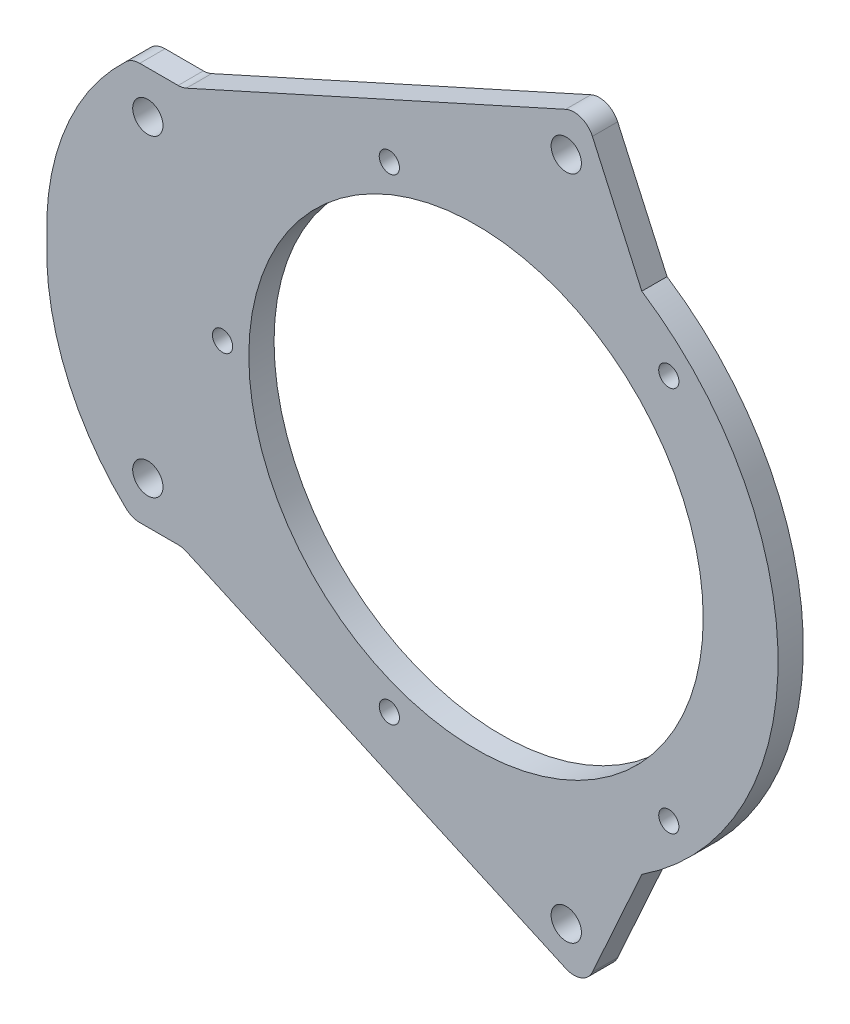
from build123d import *

# Parameters (mm, degrees)
CROQUIS1_R              = 2.25
CROQUIS1_R_2            = 3
CROQUIS1_R_3            = 1.5
CROQUIS1_R_4            = 2.249997567
SALIENTE_EXTRUIR1_DEPTH = 2.5
SALIENTE_EXTRUIR3_START = -2.5
CROQUIS6_R              = 2.250000066
CROQUIS6_R_2            = 1.5
CROQUIS6_R_3            = 2.25
SALIENTE_EXTRUIR3_DEPTH = 2.5
CROQUIS5_R              = 22.5
CROQUIS5_R_2            = 1
CORTAR_EXTRUIR5_DEPTH   = 2.5
CORTAR_EXTRUIR6_DEPTH   = 2.5
SALIENTE_EXTRUIR4_START = -2.5
CROQUIS11_R             = 1.5
CROQUIS11_R_2           = 1.500000006
SALIENTE_EXTRUIR4_DEPTH = 2.5
REDONDEO1_START         = -1
REDONDEO1_DEPTH         = 4
REDONDEO1_2_DEPTH       = 2.5
CROQUIS12_R             = 1.5
CORTAR_EXTRUIR7_DEPTH   = 2.5


with BuildPart() as part:
    # Croquis1 → Saliente-Extruir1 (new body)
    with BuildSketch(Plane.XY):
        with BuildLine():
            Line((-29.502526327, -44.949972179), (-23.17778065, -37.243838032))
            ThreePointArc((-23.17778065, -37.243838032), (-18.839723212, -32.444384768), (-14.046056443, -28.099933953))
            ThreePointArc((-14.046056443, -28.099933953), (-12.991422185, -27.658257217), (-11.867164621, -27.866527921))
            ThreePointArc((-11.867164621, -27.866527921), (-11.203313373, -28.112469078), (-10.500314, -28.196))
            Line((-10.500314, -28.196), (10.499686, -28.196))
            ThreePointArc((10.499686, -28.196), (11.203007921, -28.112542722), (11.867164264, -27.866528101))
            ThreePointArc((11.867164264, -27.866528101), (12.991422421, -27.658256674), (14.046057406, -28.099933523))
            ThreePointArc((14.046057406, -28.099933523), (18.839775902, -32.444337151), (23.177889012, -37.243749049))
            Line((23.177889012, -37.243749049), (29.502526012, -44.949972049))
            ThreePointArc((29.502526012, -44.949972049), (40.113877497, -46.255199126), (41.931739547, -35.719556022))
            Line((41.931739547, -35.719556022), (21.72923101, -5.566101046))
            ThreePointArc((21.72923101, -5.566101046), (20.036969431, -9.5e-08), (21.729230693, 5.566100954))
            Line((21.729230693, 5.566100954), (41.931739693, 35.719555954))
            ThreePointArc((41.931739693, 35.719555954), (40.113877277, 46.255198335), (29.502526336, 44.949972165))
            Line((29.502526336, 44.949972165), (23.17778065, 37.243838007))
            ThreePointArc((23.17778065, 37.243838007), (18.839723212, 32.444384742), (14.046056443, 28.099933927))
            ThreePointArc((14.046056443, 28.099933927), (12.991421988, 27.658257139), (11.867164252, 27.866528027))
            ThreePointArc((11.867164252, 27.866528027), (11.203313175, 28.112469073), (10.500314, 28.195999974))
            Line((10.500314, 28.195999974), (-10.500314, 28.195999974))
            ThreePointArc((-10.500314, 28.195999974), (-11.203313178, 28.112469098), (-11.867164264, 27.866528075))
            ThreePointArc((-11.867164264, 27.866528075), (-12.991422421, 27.658256648), (-14.046057406, 28.099933497))
            ThreePointArc((-14.046057406, 28.099933497), (-18.839775902, 32.444337126), (-23.177889012, 37.243749023))
            Line((-23.177889012, 37.243749023), (-29.502526012, 44.949972023))
            ThreePointArc((-29.502526012, 44.949972023), (-40.146302424, 46.230987494), (-41.886340556, 35.652554517))
            ThreePointArc((-41.886340556, 35.652554517), (-41.288874902, 25.337679941), (-50.13550001, 20.000000021))
            Line((-50.13550001, 20.000000021), (-97.31807601, 20.000000021))
            ThreePointArc((-97.31807601, 20.000000021), (-99.1994919, 19.554558541), (-100.681450855, 18.312809163))
            add(Edge.make_bspline(
                [(-107.31807554, 2.1e-08), (-107.252414123, 7.059743944), (-104.975710329, 13.164639039), (-100.681450855, 18.312809163)],
                knots=[0, 0, 0, 0, 1, 1, 1, 1], degree=3))
            add(Edge.make_bspline(
                [(-107.31807554, 2.1e-08), (-107.252414123, -7.059743902), (-104.975710329, -13.164638997), (-100.681450855, -18.312809121)],
                knots=[0, 0, 0, 0, 1, 1, 1, 1], degree=3))
            ThreePointArc((-100.681450855, -18.312809121), (-99.19949186, -19.554558345), (-97.31807601, -19.9999997))
            Line((-97.31807601, -19.9999997), (-50.13550001, -19.9999997))
            ThreePointArc((-50.13550001, -19.9999997), (-41.288874902, -25.33767962), (-41.886340556, -35.652554196))
            ThreePointArc((-41.886340556, -35.652554196), (-40.146302646, -46.230987042), (-29.502526327, -44.949972179))
        make_face()
        with Locations((-25.371621, 27.641642)):
            Circle(CROQUIS1_R, mode=Mode.SUBTRACT)
        with Locations((-35.493242035, 40.033284004)):
            Circle(CROQUIS1_R, mode=Mode.SUBTRACT)
        with Locations((-35.49324201, -40.0332837)):
            Circle(CROQUIS1_R, mode=Mode.SUBTRACT)
        with Locations((15.25, -15.25)):
            Circle(CROQUIS1_R_2, mode=Mode.SUBTRACT)
        with Locations((35.493242035, -40.03328403)):
            Circle(CROQUIS1_R, mode=Mode.SUBTRACT)
        with Locations((-15.25, 15.25)):
            Circle(CROQUIS1_R_2, mode=Mode.SUBTRACT)
        with Locations((-25.371621, -27.641642)):
            Circle(CROQUIS1_R, mode=Mode.SUBTRACT)
        with Locations((-35.318076, 15.5)):
            Circle(CROQUIS1_R_3, mode=Mode.SUBTRACT)
        with Locations((25.371621, -27.641642)):
            Circle(CROQUIS1_R, mode=Mode.SUBTRACT)
        with Locations((-15.25, -15.25)):
            Circle(CROQUIS1_R_2, mode=Mode.SUBTRACT)
        with Locations((-97.318076, 15.5)):
            Circle(CROQUIS1_R_3, mode=Mode.SUBTRACT)
        with Locations((15.25, 15.25)):
            Circle(CROQUIS1_R_2, mode=Mode.SUBTRACT)
        with Locations((-35.318076, -15.5)):
            Circle(CROQUIS1_R_3, mode=Mode.SUBTRACT)
        with Locations((25.371621, 27.641642)):
            Circle(CROQUIS1_R, mode=Mode.SUBTRACT)
        with Locations((-97.318076, -15.5)):
            Circle(CROQUIS1_R_3, mode=Mode.SUBTRACT)
        with Locations((35.493241695, 40.03328329)):
            Circle(CROQUIS1_R_4, mode=Mode.SUBTRACT)
        with BuildLine():
            Line((10.499686, -24.196), (-10.500314, -24.196))
            ThreePointArc((-10.500314, -24.196), (-11.500314, -25.196), (-10.500314, -26.196))
            Line((-10.500314, -26.196), (10.499686, -26.196))
            ThreePointArc((10.499686, -26.196), (11.499686, -25.196), (10.499686, -24.196))
        make_face(mode=Mode.SUBTRACT)
        with BuildLine():
            Line((10.499686, 24.196), (-10.500314, 24.196))
            ThreePointArc((-10.500314, 24.196), (-11.500314, 25.196), (-10.500314, 26.196))
            Line((-10.500314, 26.196), (10.499686, 26.196))
            ThreePointArc((10.499686, 26.196), (11.499686, 25.196), (10.499686, 24.196))
        make_face(mode=Mode.SUBTRACT)
    extrude(amount=SALIENTE_EXTRUIR1_DEPTH)


with BuildPart() as saliente_extruir3_tool:
    # Croquis6 → Saliente-Extruir3 (new body)
    # profile 1 of 10: a face of its own
    with BuildSketch(Plane.XY.offset(2.5).offset(SALIENTE_EXTRUIR3_START)):
        with Locations((-35.493242163, 40.033284025)):
            Circle(CROQUIS6_R)
        with Locations((-35.493242163, 40.033284025)):
            Circle(CROQUIS6_R_2, mode=Mode.SUBTRACT)
    # profile 2 of 10: a face of its own
    with BuildSketch(Plane.XY.offset(2.5).offset(SALIENTE_EXTRUIR3_START)):
        with Locations((-25.371621, 27.641642)):
            Circle(CROQUIS6_R_3)
        with Locations((-25.371621, 27.641642)):
            Circle(CROQUIS6_R_2, mode=Mode.SUBTRACT)
    # profile 3 of 10: a face of its own
    with BuildSketch(Plane.XY.offset(2.5).offset(SALIENTE_EXTRUIR3_START)):
        with Locations((25.371621, 27.641642)):
            Circle(CROQUIS6_R_3)
        with Locations(Location((25.371621, 27.641642, 0), (0, 0, 180))):
            Circle(CROQUIS6_R_2, mode=Mode.SUBTRACT)
    # profile 4 of 10: a face of its own
    with BuildSketch(Plane.XY.offset(2.5).offset(SALIENTE_EXTRUIR3_START)):
        with Locations((35.493242163, 40.033284025)):
            Circle(CROQUIS6_R)
        with Locations(Location((35.493242163, 40.033284025, 0), (0, 0, 180))):
            Circle(CROQUIS6_R_2, mode=Mode.SUBTRACT)
    # profile 5 of 10: a face of its own
    with BuildSketch(Plane.XY.offset(2.5).offset(SALIENTE_EXTRUIR3_START)):
        with Locations((35.493242163, -40.033284025)):
            Circle(CROQUIS6_R)
        with Locations((35.493242163, -40.033284025)):
            Circle(CROQUIS6_R_2, mode=Mode.SUBTRACT)
    # profile 6 of 10: a face of its own
    with BuildSketch(Plane.XY.offset(2.5).offset(SALIENTE_EXTRUIR3_START)):
        with Locations((25.371621, -27.641642)):
            Circle(CROQUIS6_R_3)
        with Locations((25.371621, -27.641642)):
            Circle(CROQUIS6_R_2, mode=Mode.SUBTRACT)
    # profile 7 of 10: a face of its own
    with BuildSketch(Plane.XY.offset(2.5).offset(SALIENTE_EXTRUIR3_START)):
        with Locations((-25.371621, -27.641642)):
            Circle(CROQUIS6_R_3)
        with Locations(Location((-25.371621, -27.641642, 0), (0, 0, 180))):
            Circle(CROQUIS6_R_2, mode=Mode.SUBTRACT)
    # profile 8 of 10: a face of its own
    with BuildSketch(Plane.XY.offset(2.5).offset(SALIENTE_EXTRUIR3_START)):
        with Locations((-35.493242163, -40.033284025)):
            Circle(CROQUIS6_R)
        with Locations(Location((-35.493242163, -40.033284025, 0), (0, 0, 180))):
            Circle(CROQUIS6_R_2, mode=Mode.SUBTRACT)
    # profile 9 of 10: a face of its own
    with BuildSketch(Plane.XY.offset(2.5).offset(SALIENTE_EXTRUIR3_START)):
        with BuildLine():
            Line((-99.1994919, 19.554558541), (-40.146302424, 46.230987494))
            ThreePointArc((-40.146302424, 46.230987494), (-43.140478024, 41.291171845), (-41.886340556, 35.652554517))
            ThreePointArc((-41.886340556, 35.652554517), (-41.288875033, 25.33768001), (-50.13550001, 20.000000021))
            Line((-50.13550001, 20.000000021), (-97.31807601, 20.000000021))
            ThreePointArc((-97.31807601, 20.000000021), (-98.214581153, 19.590579436), (-99.1994919, 19.554558541))
        make_face()
    # profile 10 of 10: a face of its own
    with BuildSketch(Plane.XY.offset(2.5).offset(SALIENTE_EXTRUIR3_START)):
        with BuildLine():
            Line((-50.13550001, -20.000000021), (-97.31807601, -20.000000021))
            ThreePointArc((-97.31807601, -20.000000021), (-98.214581153, -19.590579436), (-99.1994919, -19.554558541))
            Line((-99.1994919, -19.554558541), (-40.146302424, -46.230987494))
            ThreePointArc((-40.146302424, -46.230987494), (-43.140478024, -41.291171845), (-41.886340556, -35.652554517))
            ThreePointArc((-41.886340556, -35.652554517), (-41.288875033, -25.33768001), (-50.13550001, -20.000000021))
        make_face()
    extrude(amount=SALIENTE_EXTRUIR3_DEPTH)


with BuildPart() as part_1:
    add(part.part)


with BuildPart() as part_2:
    # Saliente-Extruir3: joined with saliente_extruir3_tool
    add(part_1.part.fuse(saliente_extruir3_tool.part, tol=0.00001))

    # Croquis5 → Cortar-Extruir5 (cut)
    with BuildSketch(Plane.XY.offset(2.5)):
        with Locations((-69.81807554, 2.1e-08)):
            Circle(CROQUIS5_R)
        with Locations((-78.402781137, 23.586284803)):
            Circle(CROQUIS5_R_2)
        with Locations((-94.91807554, 2.1e-08)):
            Circle(CROQUIS5_R_2)
        with Locations(Location((-78.402781137, -23.586284761, 0), (0, 0, 180))):
            Circle(CROQUIS5_R_2)
        with Locations((-50.726192448, 19.091883113)):
            Circle(CROQUIS5_R_2)
        with Locations(Location((-50.726192448, -19.091883071, 0), (0, 0, 180))):
            Circle(CROQUIS5_R_2)
    extrude(amount=-CORTAR_EXTRUIR5_DEPTH, mode=Mode.SUBTRACT)

    # Croquis10 → Cortar-Extruir6 (cut)
    with BuildSketch(Plane.XY.offset(2.5)):
        with BuildLine():
            ThreePointArc((-82.134030611, -27.263635217), (-39.901716207, 2.1e-08), (-82.134030596, 27.263635224))
            ThreePointArc((-82.134030596, 27.263635224), (79.537301339, -4.3e-08), (-82.134030611, -27.263635217))
        make_face()
    extrude(amount=-CORTAR_EXTRUIR6_DEPTH, mode=Mode.SUBTRACT)

    # Croquis11 → Saliente-Extruir4 (add)
    # profile 1 of 5: a face of its own
    with BuildSketch(Plane.XY.offset(2.5).offset(SALIENTE_EXTRUIR4_START)):
        with Locations((-97.318076, 15.5)):
            Circle(CROQUIS11_R)
    # profile 2 of 5: a face of its own
    with BuildSketch(Plane.XY.offset(2.5).offset(SALIENTE_EXTRUIR4_START)):
        with Locations((-97.318076, -15.5)):
            Circle(CROQUIS11_R)
    # profile 3 of 5: a face of its own
    with BuildSketch(Plane.XY.offset(2.5).offset(SALIENTE_EXTRUIR4_START)):
        with BuildLine():
            Line((-82.134030604, -27.263635221), (-59.115036511, -37.6621347))
            Line((-59.115036511, -37.6621347), (-53.398623675, -25.007801874))
            ThreePointArc((-53.398623675, -25.007801874), (-67.476736709, -29.824598689), (-82.134030604, -27.263635221))
        make_face()
        with Locations((-60.881562628, -32.984594162)):
            Circle(CROQUIS11_R_2, mode=Mode.SUBTRACT)
    # profile 4 of 5: a face of its own
    with BuildSketch(Plane.XY.offset(2.5).offset(SALIENTE_EXTRUIR4_START)):
        with BuildLine():
            Line((-53.398623675, 25.007801874), (-59.115036511, 37.6621347))
            Line((-59.115036511, 37.6621347), (-82.134030604, 27.263635221))
            ThreePointArc((-82.134030604, 27.263635221), (-67.476736709, 29.824598692), (-53.398623675, 25.007801874))
        make_face()
        with Locations((-60.881562628, 32.984594162)):
            Circle(CROQUIS11_R, mode=Mode.SUBTRACT)
    # profile 5 of 5: a face of its own
    with BuildSketch(Plane.XY.offset(2.5).offset(SALIENTE_EXTRUIR4_START)):
        with BuildLine():
            Line((-98.888624327, -19.694988496), (-103.888624327, -19.694988496))
            ThreePointArc((-103.888624327, -19.694988496), (-110.319866599, -10.796162946), (-112.31807554, 0))
            ThreePointArc((-112.31807554, 0), (-110.319866599, 10.796162946), (-103.888624327, 19.694988496))
            Line((-103.888624327, 19.694988496), (-98.888624327, 19.694988496))
            Line((-98.888624327, 19.694988496), (-99.19948756, 19.554560502))
            ThreePointArc((-99.19948756, 19.554560502), (-100.01296612, 19.020205966), (-100.681450855, 18.312809121))
            add(Edge.make_bspline(
                [(-107.31807554, -9.16e-07), (-107.252414182, 7.059743008), (-104.975710439, 13.164638122), (-100.681450855, 18.312809121)],
                knots=[0, 0, 0, 0, 1, 1, 1, 1], degree=3))
            add(Edge.make_bspline(
                [(-107.31807554, -9.16e-07), (-107.252414123, -7.059743902), (-104.975710329, -13.164638997), (-100.681450855, -18.312809121)],
                knots=[0, 0, 0, 0, 1, 1, 1, 1], degree=3))
            ThreePointArc((-100.681450855, -18.312809121), (-100.01296612, -19.020205966), (-99.19948756, -19.554560502))
            Line((-99.19948756, -19.554560502), (-98.888624327, -19.694988496))
        make_face()
    extrude(amount=SALIENTE_EXTRUIR4_DEPTH)

    # Redondeo1: read off the stored shape, not the designer's step
    # Redondeo1 outline → Redondeo1 (cut)
    with BuildSketch(Plane.XY.offset(REDONDEO1_START)):
        with BuildLine():
            ThreePointArc((-58.291677299, -35.839477414), (-59.407724144, -36.887134414), (-60.937693806, -36.838775491))
            Line((-60.937693806, -36.838775491), (-59.115036514, -37.662134706))
            Line((-59.115036514, -37.662134706), (-58.291677299, -35.839477414))
        make_face()
        with BuildLine():
            ThreePointArc((-103.11356154, -19.694988496), (-103.851613757, -19.553826554), (-104.48548109, -19.150267421))
            ThreePointArc((-104.48548109, -19.150267421), (-104.189253686, -19.425039593), (-103.888624327, -19.694988496))
            Line((-103.888624327, -19.694988496), (-103.11356154, -19.694988496))
        make_face()
        with BuildLine():
            Line((-59.115036514, 37.662134706), (-60.937693806, 36.838775491))
            ThreePointArc((-60.937693806, 36.838775491), (-59.407724144, 36.887134414), (-58.291677299, 35.839477414))
            Line((-58.291677299, 35.839477414), (-59.115036514, 37.662134706))
        make_face()
        with BuildLine():
            ThreePointArc((-104.48548109, 19.150267421), (-103.851613757, 19.553826554), (-103.11356154, 19.694988496))
            Line((-103.11356154, 19.694988496), (-103.888624327, 19.694988496))
            ThreePointArc((-103.888624327, 19.694988496), (-104.189253686, 19.425039593), (-104.48548109, 19.150267421))
        make_face()
    extrude(amount=REDONDEO1_DEPTH, mode=Mode.SUBTRACT)

    # Redondeo1 2 outline → Redondeo1 2 (add)
    with BuildSketch(Plane.XY):
        with BuildLine():
            Line((-98.888624327, -19.694988496), (-99.319402789, -19.694988496))
            ThreePointArc((-99.319402789, -19.694988496), (-98.898282013, -19.739826792), (-98.496043574, -19.872331205))
            Line((-98.496043574, -19.872331205), (-98.888624327, -19.694988496))
        make_face()
        with BuildLine():
            ThreePointArc((-98.496043574, 19.872331205), (-98.898282013, 19.739826792), (-99.319402789, 19.694988496))
            Line((-99.319402789, 19.694988496), (-98.888619399, 19.694988496))
            Line((-98.888619399, 19.694988496), (-98.496043574, 19.872331205))
        make_face()
    extrude(amount=REDONDEO1_2_DEPTH)

    # Croquis12 → Cortar-Extruir7 (cut)
    with BuildSketch(Plane.XY.offset(2.5)):
        with Locations((-102.318076, -15.5)):
            Circle(CROQUIS12_R)
        with Locations((-102.318076, 15.5)):
            Circle(CROQUIS12_R)
    extrude(amount=-CORTAR_EXTRUIR7_DEPTH, mode=Mode.SUBTRACT)


solid = part_2.part
